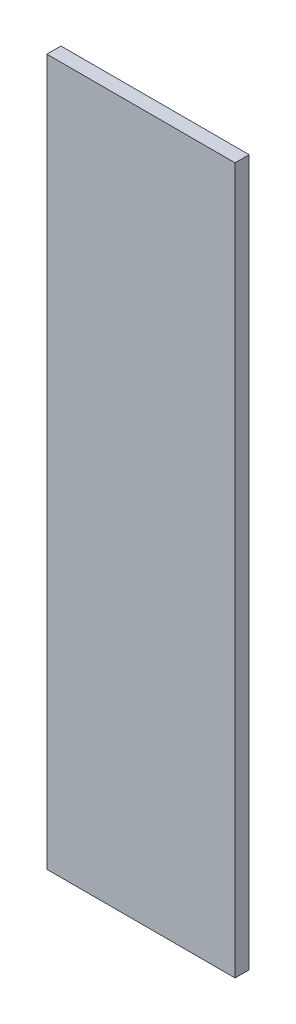
from build123d import *

# Parameters (mm, degrees)
SKETCH1_W          = 40
SKETCH1_H          = 150
BASE_FLANGE1_DEPTH = 3


# Sheet-metal steps are written as plain solids
with BuildPart() as part:
    # Sketch1 → Base-Flange1 (new body)
    with BuildSketch(Plane.XY):
        with Locations((20, 75)):
            Rectangle(SKETCH1_W, SKETCH1_H)
    extrude(amount=-BASE_FLANGE1_DEPTH)


solid = part.part
